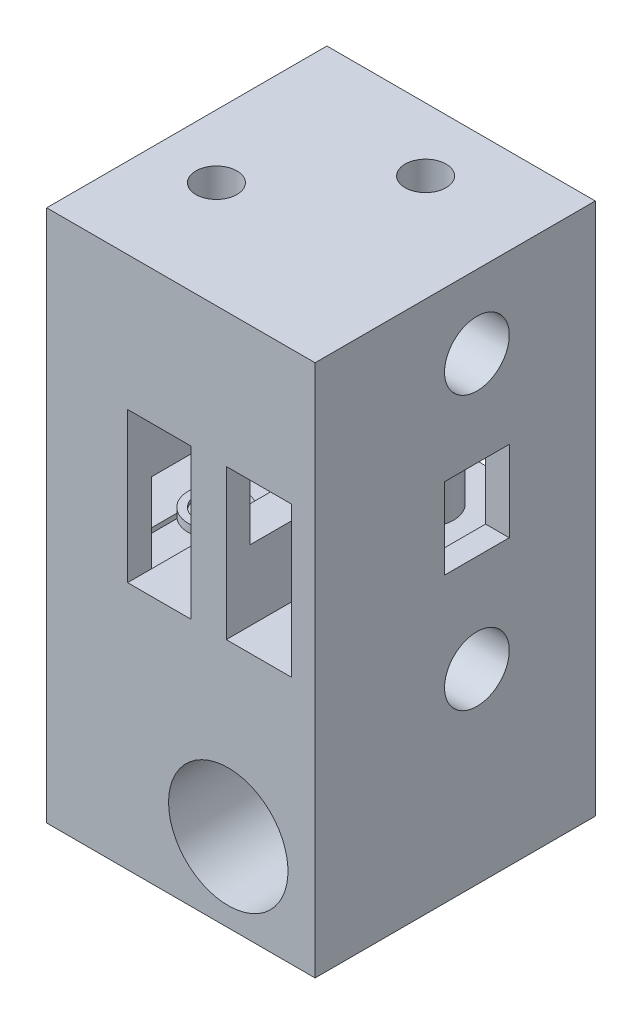
from build123d import *

# Parameters (mm, degrees)
TOP_SKETCH1_W                           = 34
TOP_SKETCH1_H                           = 35.5
TOP_SKETCH1_R                           = 2.6
BOSS_EXTRUDE4_DEPTH                     = 17
TOPRIGHTRISERBOSS_EXTRUDE5_START        = 9.9
TOPRIGHTRISER_R                         = 2.6
TOPRIGHTRISERBOSS_EXTRUDE5_DEPTH        = 9.9
TOPLEFTBOSS_EXTRUDE6_START              = 0.4
TOPLEFT_R                               = 2.6
TOPLEFTBOSS_EXTRUDE6_DEPTH              = 0.4
MIDWALL_W                               = 10.25
MIDWALL_H                               = 3
MIDWALL_W_2                             = 4.5
MIDWALL_W_3                             = 3
MIDWALL_H_2                             = 35.5
MIDWALLBOSS_EXTRUDE7_DEPTH              = 19
BOTTOM_W                                = 34
BOTTOM_H                                = 35.5
BOTTOMBOSS_EXTRUDE8_DEPTH               = 31.5
LOWERRIGHT_R                            = 2.6
LOWERRIGHTRIGHTBOSS_EXTRUDE10_DEPTH     = 0.4
LOWERLEFT_R                             = 2.6
LOWERLEFTRISERBOSS_EXTRUDE9_DEPTH       = 9.9
TOPRIGHTINSET_CUT_EXTRUDE1_DEPTH        = 1
TOPLEFTINSET_CUT_EXTRUDE2_DEPTH         = 1
LOWERLEFTINSET_CUT_EXTRUDE3_START       = -1
LOWERLEFTINSET_CUT_EXTRUDE3_DEPTH       = 1
LOWERRIGHTINSETCUT_EXTRUDE4_START       = -1
LOWERRIGHTINSETCUT_EXTRUDE4_DEPTH       = 1
LM8UUHOLESKETCH1_R                      = 7.5625
LM8UUCUT_EXTRUDE1_DEPTH                 = 71.473399237
XAXISRODSKETCH2_R                       = 4.1
XAXISRODCUT_EXTRUDE2_DEPTH              = 71.473399237
BACKHOLECUTCUT_EXTRUDE3_REACH           = 72.473
SKETCH3_W                               = 8.2
SKETCH3_H                               = 10.25
STEELSHAFTPUSHPINHOLESKETCH4_R          = 2
STEELSHAFTPUSHPINHOLECUT_EXTRUDE1_DEPTH = 84.501496993
LM8UUM3FASTENERSKETCH4_R                = 2.1
LM8UUM3FASTENERCUT_EXTRUDE1_DEPTH       = 15


with BuildPart() as part:
    # Top-Sketch1 → Boss-Extrude4 (new body)
    with BuildSketch(Plane(origin=(0, 0, 0), x_dir=(1, 0, 0), z_dir=(0, 1, 0))):
        with Locations((17, 17.75)):
            Rectangle(TOP_SKETCH1_W, TOP_SKETCH1_H)
        with Locations((8, 13.5)):
            Circle(TOP_SKETCH1_R, mode=Mode.SUBTRACT)
        with Locations((20.5, 27.5)):
            Circle(TOP_SKETCH1_R, mode=Mode.SUBTRACT)
    extrude(amount=BOSS_EXTRUDE4_DEPTH)

    # TopRightRiser → TopRightRiserBoss-Extrude5 (add)
    with BuildSketch(Plane.XZ.offset(TOPRIGHTRISERBOSS_EXTRUDE5_START)):
        with BuildLine():
            Line((5.75, -10.754093956), (5.75, 0))
            Line((5.75, 0), (10.25, 0))
            Line((10.25, 0), (10.25, -10.754093956))
            ThreePointArc((10.25, -10.754093956), (8, -17.05), (5.75, -10.754093956))
        make_face()
        with Locations((8, -13.5)):
            Circle(TOPRIGHTRISER_R, mode=Mode.SUBTRACT)
    extrude(amount=-TOPRIGHTRISERBOSS_EXTRUDE5_DEPTH)

    # TopLeft → TopLeftBoss-Extrude6 (add)
    with BuildSketch(Plane.XZ.offset(TOPLEFTBOSS_EXTRUDE6_START)):
        with BuildLine():
            Line((18.25, -24.754093956), (18.25, 0))
            Line((18.25, 0), (22.75, 0))
            Line((22.75, 0), (22.75, -24.754093956))
            ThreePointArc((22.75, -24.754093956), (20.5, -31.05), (18.25, -24.754093956))
        make_face()
        with Locations((20.5, -27.5)):
            Circle(TOPLEFT_R, mode=Mode.SUBTRACT)
    extrude(amount=-TOPLEFTBOSS_EXTRUDE6_DEPTH)

    # MidWall → MidWallBoss-Extrude7 (add)
    with BuildSketch(Plane(origin=(0, 0, 0), x_dir=(-1, 0, 0), z_dir=(0, -1, 0))):
        with Locations((-5.125, 1.5)):
            Rectangle(MIDWALL_W, MIDWALL_H)
        with Locations((-20.5, 1.5)):
            Rectangle(MIDWALL_W_2, MIDWALL_H)
        with Locations((-32.5, 17.75)):
            Rectangle(MIDWALL_W_3, MIDWALL_H_2)
    extrude(amount=MIDWALLBOSS_EXTRUDE7_DEPTH)

    # Bottom → BottomBoss-Extrude8 (add)
    with BuildSketch(Plane.XZ.offset(19)):
        with Locations((17, -17.75)):
            Rectangle(BOTTOM_W, BOTTOM_H)
    extrude(amount=BOTTOMBOSS_EXTRUDE8_DEPTH)

    # LowerRight → LowerRightRightBoss-Extrude10 (add)
    with BuildSketch(Plane(origin=(0, -19, 0), x_dir=(1, 0, 0), z_dir=(0, 1, 0))):
        with BuildLine():
            Line((5.75, 10.754093956), (5.75, 3))
            Line((5.75, 3), (10.25, 3))
            Line((10.25, 3), (10.25, 10.754093956))
            ThreePointArc((10.25, 10.754093956), (8, 17.05), (5.75, 10.754093956))
        make_face()
        with Locations((8, 13.5)):
            Circle(LOWERRIGHT_R, mode=Mode.SUBTRACT)
    extrude(amount=LOWERRIGHTRIGHTBOSS_EXTRUDE10_DEPTH)

    # LowerLeft → LowerLeftRiserBoss-Extrude9 (add)
    with BuildSketch(Plane(origin=(0, -19, 0), x_dir=(1, 0, 0), z_dir=(0, 1, 0))):
        with BuildLine():
            Line((18.25, 0), (22.75, 0))
            Line((22.75, 0), (22.75, 24.754093956))
            ThreePointArc((22.75, 24.754093956), (20.5, 31.05), (18.25, 24.754093956))
            Line((18.25, 24.754093956), (18.25, 0))
        make_face()
        with Locations((20.5, 27.5)):
            Circle(LOWERLEFT_R, mode=Mode.SUBTRACT)
    extrude(amount=LOWERLEFTRISERBOSS_EXTRUDE9_DEPTH)

    # TopRightInset-Sketch1 → TopRightInset-Cut-Extrude1 (cut)
    with BuildSketch(Plane.XZ.offset(9.9)):
        with BuildLine():
            Line((5.75, -10.754093956), (5.75, -3))
            Line((5.75, -3), (10.25, -3))
            Line((10.25, -3), (10.25, -10.754093956))
            ThreePointArc((10.25, -10.754093956), (8, -9.95), (5.75, -10.754093956))
        make_face()
    extrude(amount=-TOPRIGHTINSET_CUT_EXTRUDE1_DEPTH, mode=Mode.SUBTRACT)

    # TopLeftInset-Sketch2 → TopLeftInset-Cut-Extrude2 (cut)
    with BuildSketch(Plane.XZ.offset(0.4)):
        with BuildLine():
            Line((18.25, -24.754093956), (18.25, -3))
            Line((18.25, -3), (22.75, -3))
            Line((22.75, -3), (22.75, -24.754093956))
            ThreePointArc((22.75, -24.754093956), (20.5, -23.95), (18.25, -24.754093956))
        make_face()
    extrude(amount=-TOPLEFTINSET_CUT_EXTRUDE2_DEPTH, mode=Mode.SUBTRACT)

    # LowerLeftInset-Sketch3 → LowerLeftInset-Cut-Extrude3 (cut)
    with BuildSketch(Plane(origin=(0, -9.1, 0), x_dir=(1, 0, 0), z_dir=(0, 1, 0)).offset(LOWERLEFTINSET_CUT_EXTRUDE3_START)):
        with BuildLine():
            Line((18.25, 24.754093956), (18.25, 3))
            Line((18.25, 3), (22.75, 3))
            Line((22.75, 3), (22.75, 24.754093956))
            ThreePointArc((22.75, 24.754093956), (20.5, 23.95), (18.25, 24.754093956))
        make_face()
    extrude(amount=LOWERLEFTINSET_CUT_EXTRUDE3_DEPTH, mode=Mode.SUBTRACT)

    # LowerRightInset-Sketch4 → LowerRightInsetCut-Extrude4 (cut)
    with BuildSketch(Plane(origin=(0, -18.6, 0), x_dir=(1, 0, 0), z_dir=(0, 1, 0)).offset(LOWERRIGHTINSETCUT_EXTRUDE4_START)):
        with BuildLine():
            Line((5.75, 10.754093956), (5.75, 3))
            Line((5.75, 3), (10.25, 3))
            Line((10.25, 3), (10.25, 10.754093956))
            ThreePointArc((10.25, 10.754093956), (8, 9.95), (5.75, 10.754093956))
        make_face()
    extrude(amount=LOWERRIGHTINSETCUT_EXTRUDE4_DEPTH, mode=Mode.SUBTRACT)

    # LM8UUHoleSketch1 → LM8UUCut-Extrude1 (cut, through all)
    with BuildSketch(Plane(origin=(0, 0, -35.5), x_dir=(-1, 0, 0), z_dir=(0, 0, -1))):
        with Locations((-23, -40.5)):
            Circle(LM8UUHOLESKETCH1_R)
    extrude(amount=-LM8UUCUT_EXTRUDE1_DEPTH, mode=Mode.SUBTRACT)

    # XAxisRodSketch2 → XAxisRodCut-Extrude2 (cut, through all)
    with BuildSketch(Plane.ZY):
        with Locations((-20.5, -26.85)):
            Circle(XAXISRODSKETCH2_R)
        with Locations((-20.5, 7.75)):
            Circle(XAXISRODSKETCH2_R)
    extrude(amount=-XAXISRODCUT_EXTRUDE2_DEPTH, mode=Mode.SUBTRACT)

    # Sketch3 → BackHoleCutCut-Extrude3 (cut, up to next)
    with BuildSketch(Plane(origin=(34, 0, 0), x_dir=(0, 0, -1), z_dir=(1, 0, 0)), mode=Mode.PRIVATE) as backholecutcut_extrude3_sk1:
        with Locations((20.5, -9.375)):
            Rectangle(SKETCH3_W, SKETCH3_H)
    backholecutcut_extrude3_tool1 = extrude(backholecutcut_extrude3_sk1.sketch, amount=-BACKHOLECUTCUT_EXTRUDE3_REACH, mode=Mode.PRIVATE) & part.part
    add(backholecutcut_extrude3_tool1.solids().sort_by_distance((34, -9.375, -20.5))[0], mode=Mode.SUBTRACT)

    # SteelShaftPushPinHoleSketch4 → SteelShaftpushPinHoleCut-Extrude1 (cut, through all)
    with BuildSketch(Plane.XZ.offset(50.5)):
        with Locations((8, -13.5)):
            Circle(STEELSHAFTPUSHPINHOLESKETCH4_R)
        with Locations((20.5, -27.5)):
            Circle(STEELSHAFTPUSHPINHOLESKETCH4_R)
    extrude(amount=-STEELSHAFTPUSHPINHOLECUT_EXTRUDE1_DEPTH, mode=Mode.SUBTRACT)

    # LM8UUM3FastenerSketch4 → LM8UUM3FastenerCut-Extrude1 (cut)
    with BuildSketch(Plane.XZ.offset(50.5)):
        with Locations((14.4, -20.5)):
            Circle(LM8UUM3FASTENERSKETCH4_R)
    extrude(amount=-LM8UUM3FASTENERCUT_EXTRUDE1_DEPTH, mode=Mode.SUBTRACT)


solid = part.part
